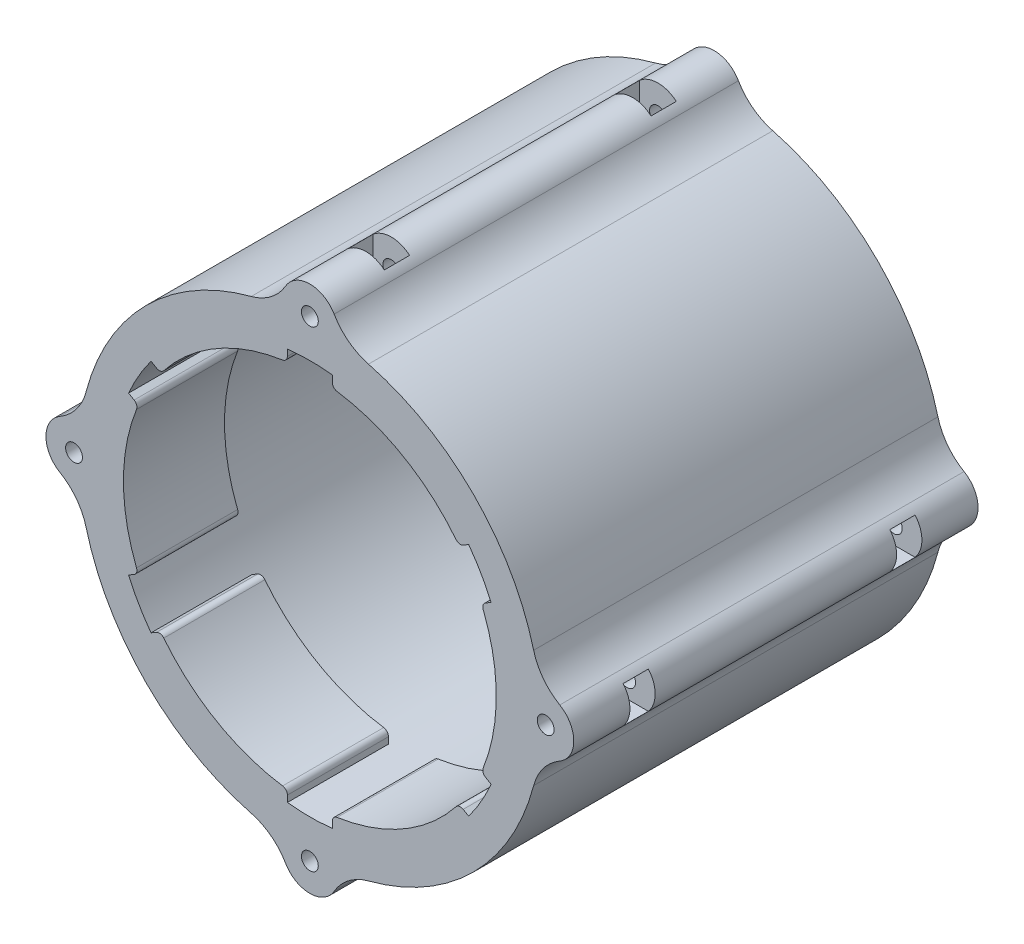
from build123d import *

# Parameters (mm, degrees)
IZIM1_R                     = 35.2
IZIM1_R_2                   = 1.5
Y_KSEKLIK_EKSTR_ZYON1_DEPTH = 72
Y_KSEKLIK_EKSTR_ZYON2_START = -18
Y_KSEKLIK_EKSTR_ZYON2_DEPTH = 18
KES_EKSTR_ZYON1_DEPTH       = 4.5
DAIRESEL_KAPLAMA1_COUNT     = 4
AYNALAMA1_COPY_1_DEPTH      = 4.5
AYNALAMA1_COPY_2_DEPTH      = 4.5
AYNALAMA1_COPY_3_DEPTH      = 4.5
AYNALAMA1_COPY_4_DEPTH      = 4.5
RADYUS1_R                   = 1


with BuildPart() as part:
    # Çizim1 → Yükseklik-Ekstrüzyon1 (new body)
    with BuildSketch(Plane.XY):
        with BuildLine():
            ThreePointArc((-39.855405506, -10.439667234), (-29.132799385, -29.132799385), (-10.439667234, -39.855405506))
            ThreePointArc((-10.439667234, -39.855405506), (-6.917154276, -41.571669638), (-4.324522349, -44.50968254))
            ThreePointArc((-4.324522349, -44.50968254), (0, -47), (4.324522349, -44.50968254))
            ThreePointArc((4.324522349, -44.50968254), (6.917154276, -41.571669638), (10.439667234, -39.855405506))
            ThreePointArc((10.439667234, -39.855405506), (29.132799385, -29.132799385), (39.855405506, -10.439667234))
            ThreePointArc((39.855405506, -10.439667234), (41.571669638, -6.917154276), (44.50968254, -4.324522349))
            ThreePointArc((44.50968254, -4.324522349), (47, 0), (44.50968254, 4.324522349))
            ThreePointArc((44.50968254, 4.324522349), (41.571669638, 6.917154276), (39.855405506, 10.439667234))
            ThreePointArc((39.855405506, 10.439667234), (29.132799385, 29.132799385), (10.439667234, 39.855405506))
            ThreePointArc((10.439667234, 39.855405506), (6.917154276, 41.571669638), (4.324522349, 44.50968254))
            ThreePointArc((4.324522349, 44.50968254), (0, 47), (-4.324522349, 44.50968254))
            ThreePointArc((-4.324522349, 44.50968254), (-6.917154276, 41.571669638), (-10.439667234, 39.855405506))
            ThreePointArc((-10.439667234, 39.855405506), (-29.132799385, 29.132799385), (-39.855405506, 10.439667234))
            ThreePointArc((-39.855405506, 10.439667234), (-41.571669638, 6.917154276), (-44.50968254, 4.324522349))
            ThreePointArc((-44.50968254, 4.324522349), (-47, 0), (-44.50968254, -4.324522349))
            ThreePointArc((-44.50968254, -4.324522349), (-41.571669638, -6.917154276), (-39.855405506, -10.439667234))
        make_face()
        Circle(IZIM1_R, mode=Mode.SUBTRACT)
        with Locations((-42, 0)):
            Circle(IZIM1_R_2, mode=Mode.SUBTRACT)
        with Locations((0, 42)):
            Circle(IZIM1_R_2, mode=Mode.SUBTRACT)
        with Locations((42, 0)):
            Circle(IZIM1_R_2, mode=Mode.SUBTRACT)
        with Locations((0, -42)):
            Circle(IZIM1_R_2, mode=Mode.SUBTRACT)
    extrude(amount=Y_KSEKLIK_EKSTR_ZYON1_DEPTH)

    # Çizim2 → Yükseklik-Ekstrüzyon2 (add)
    with BuildSketch(Plane.XY.offset(72).offset(Y_KSEKLIK_EKSTR_ZYON2_START)):
        with BuildLine():
            Line((-4, 34.971988791), (-4, 32.958155288))
            ThreePointArc((-4, 32.958155288), (-16.6, 28.752043406), (-26.542599741, 19.943179259))
            Line((-26.542599741, 19.943179259), (-28.286630714, 20.950096011))
            ThreePointArc((-28.286630714, 20.950096011), (-17.6, 30.484094213), (-4, 34.971988791))
        make_face()
        with BuildLine():
            Line((4, 34.971988791), (4, 32.958155288))
            ThreePointArc((4, 32.958155288), (16.6, 28.752043406), (26.542599741, 19.943179259))
            Line((26.542599741, 19.943179259), (28.286630714, 20.950096011))
            ThreePointArc((28.286630714, 20.950096011), (17.6, 30.484094213), (4, 34.971988791))
        make_face()
        with BuildLine():
            Line((32.286630714, 14.02189278), (30.542599741, 13.014976029))
            ThreePointArc((30.542599741, 13.014976029), (33.2, 0), (30.542599741, -13.014976029))
            Line((30.542599741, -13.014976029), (32.286630714, -14.02189278))
            ThreePointArc((32.286630714, -14.02189278), (35.2, 0), (32.286630714, 14.02189278))
        make_face()
        with BuildLine():
            Line((28.286630714, -20.950096011), (26.542599741, -19.943179259))
            ThreePointArc((26.542599741, -19.943179259), (16.6, -28.752043406), (4, -32.958155288))
            Line((4, -32.958155288), (4, -34.971988791))
            ThreePointArc((4, -34.971988791), (17.6, -30.484094213), (28.286630714, -20.950096011))
        make_face()
        with BuildLine():
            Line((-4, -34.971988791), (-4, -32.958155288))
            ThreePointArc((-4, -32.958155288), (-16.6, -28.752043406), (-26.542599741, -19.943179259))
            Line((-26.542599741, -19.943179259), (-28.286630714, -20.950096011))
            ThreePointArc((-28.286630714, -20.950096011), (-17.6, -30.484094213), (-4, -34.971988791))
        make_face()
        with BuildLine():
            Line((-32.286630714, -14.02189278), (-30.542599741, -13.014976029))
            ThreePointArc((-30.542599741, -13.014976029), (-33.2, 0), (-30.542599741, 13.014976029))
            Line((-30.542599741, 13.014976029), (-32.286630714, 14.02189278))
            ThreePointArc((-32.286630714, 14.02189278), (-35.2, 0), (-32.286630714, -14.02189278))
        make_face()
    extrude(amount=Y_KSEKLIK_EKSTR_ZYON2_DEPTH)

    # Çizim3 → Kes-Ekstrüzyon1 (cut)
    with BuildSketch(Plane(origin=(0, 0, 10), x_dir=(-1, 0, 0), z_dir=(0, 0, -1))):
        Polygon((-3.262029021, -42), (-3.262029021, -48), (3.262029021, -48), (3.262029021, -42), (1.63101451, -39.175), (-1.63101451, -39.175), align=None)
    kes_ekstr_zyon1 = extrude(amount=-KES_EKSTR_ZYON1_DEPTH, mode=Mode.SUBTRACT)

    # Dairesel Kaplama1: Kes-Ekstrüzyon1 ×4 about axis
    dairesel_kaplama1_axis = Axis((0, 0, 0), (0, 0, 1))
    for i in range(1, DAIRESEL_KAPLAMA1_COUNT):
        add(kes_ekstr_zyon1.rotate(dairesel_kaplama1_axis, i * 360 / DAIRESEL_KAPLAMA1_COUNT), mode=Mode.SUBTRACT)

    # Aynalama1 copy 1 sketch → Aynalama1 copy 1 (cut)
    with BuildSketch(Plane(origin=(0, 0, 62), x_dir=(0, -1, 0), z_dir=(0, 0, 1))):
        Polygon((-3.262029021, 42), (-3.262029021, 48), (3.262029021, 48), (3.262029021, 42), (1.63101451, 39.175), (-1.63101451, 39.175), align=None)
    extrude(amount=-AYNALAMA1_COPY_1_DEPTH, mode=Mode.SUBTRACT)

    # Aynalama1 copy 2 sketch → Aynalama1 copy 2 (cut)
    with BuildSketch(Plane.XY.offset(62)):
        Polygon((-3.262029021, 42), (-3.262029021, 48), (3.262029021, 48), (3.262029021, 42), (1.63101451, 39.175), (-1.63101451, 39.175), align=None)
    extrude(amount=-AYNALAMA1_COPY_2_DEPTH, mode=Mode.SUBTRACT)

    # Aynalama1 copy 3 sketch → Aynalama1 copy 3 (cut)
    with BuildSketch(Plane(origin=(0, 0, 62), x_dir=(0, 1, 0), z_dir=(0, 0, 1))):
        Polygon((-3.262029021, 42), (-3.262029021, 48), (3.262029021, 48), (3.262029021, 42), (1.63101451, 39.175), (-1.63101451, 39.175), align=None)
    extrude(amount=-AYNALAMA1_COPY_3_DEPTH, mode=Mode.SUBTRACT)

    # Aynalama1 copy 4 sketch → Aynalama1 copy 4 (cut)
    with BuildSketch(Plane(origin=(0, 0, 62), x_dir=(-1, 0, 0), z_dir=(0, 0, 1))):
        Polygon((-3.262029021, 42), (-3.262029021, 48), (3.262029021, 48), (3.262029021, 42), (1.63101451, 39.175), (-1.63101451, 39.175), align=None)
    extrude(amount=-AYNALAMA1_COPY_4_DEPTH, mode=Mode.SUBTRACT)

    # Radyus1
    radyus1_edges = [part.edges().sort_by_distance(p)[0] for p in [
        (4, 32.958155288, 63),
        (-4, 32.958155288, 63),
        (26.542599741, -19.943179259, 63),
        (30.542599741, -13.014976029, 63),
        (-4, -32.958155288, 63),
        (4, -32.958155288, 63),
        (-26.542599741, -19.943179259, 63),
        (-30.542599741, -13.014976029, 63),
        (-30.542599741, 13.014976029, 63),
        (-26.542599741, 19.943179259, 63),
        (30.542599741, 13.014976029, 63),
        (26.542599741, 19.943179259, 63),
    ]]
    fillet(radyus1_edges, radius=RADYUS1_R)


solid = part.part
